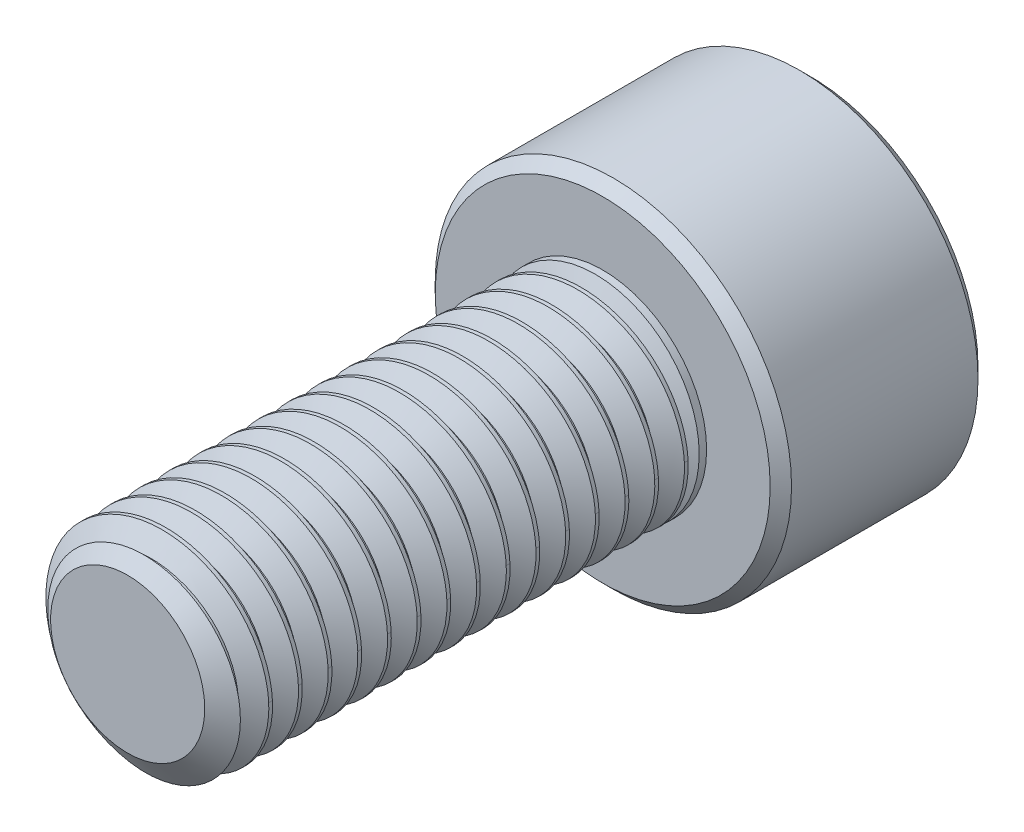
from build123d import *

# Parameters (mm, degrees)
SKETCH1_R          = 3.5
EXTRUDE1_DEPTH     = 16
CUT_SWEEP1_PITCH   = 1
SKETCH6_R          = 6
EXTRUDE2_DEPTH     = 7
CUT_EXTRUDE1_DEPTH = 4.5
CHAMFER1_SIZE      = 0.36


with BuildPart() as part:
    # Sketch1 → Extrude1 (new body)
    with BuildSketch(Plane.XY):
        Circle(SKETCH1_R)
    extrude(amount=-EXTRUDE1_DEPTH)

    # Cut-Sweep1: the profile of Sketch3 profile screwed along a right-hand helix of 17 turns, 6 arcs to a turn; built about Z, then put on its axis
    cut_sweep1_z = Axis((0, 0, 0), (0, 0, 1))
    cut_sweep1_corners = [(3.5003, 0, -0.875173205), (2.850480947, 0, -0.5), (2.850480947, 0, -0.375), (3.5003, 0, 0.000173205)]
    with BuildLine(mode=Mode.PRIVATE) as cut_sweep1_profile:
        Line(cut_sweep1_corners[0], cut_sweep1_corners[1])
        Line(cut_sweep1_corners[1], cut_sweep1_corners[2])
        Line(cut_sweep1_corners[2], cut_sweep1_corners[3])
        Line(cut_sweep1_corners[3], cut_sweep1_corners[0])
    cut_sweep1_cap = Face(cut_sweep1_profile.wire())
    cut_sweep1_turn_angles = [0, 30, 60, 90, 120, 150, 180, 210, 240, 270, 300, 330, 360]
    cut_sweep1_turn_weights = [1, 0.8660254037844387, 1, 0.8660254037844387, 1, 0.8660254037844387, 1, 0.8660254037844387, 1, 0.8660254037844387, 1, 0.8660254037844387, 1]
    cut_sweep1_turn_rails = [Edge.make_bspline([Vector(p[0], p[1], 0).rotate(cut_sweep1_z, cut_sweep1_turn_angles[k]) / cut_sweep1_turn_weights[k] + Vector(0, 0, p[2] + CUT_SWEEP1_PITCH * cut_sweep1_turn_angles[k] / 360) for k in range(13)], [0, 0, 0, 1, 1, 2, 2, 3, 3, 4, 4, 5, 5, 6, 6, 6], 2, cut_sweep1_turn_weights) for p in cut_sweep1_corners]
    cut_sweep1_turn_sides = [Face.make_surface_from_curves(cut_sweep1_turn_rails[p[0]], cut_sweep1_turn_rails[p[1]]) for p in [(0, 1), (1, 2), (2, 3), (3, 0)]]
    cut_sweep1 = Plane(origin=(0, 0, 0), x_dir=(0, 1, 0), z_dir=(0, 0, -1)) * Solid(Shell([*[p.moved(Location((0, 0, CUT_SWEEP1_PITCH * i))) for i in range(17) for p in cut_sweep1_turn_sides], cut_sweep1_cap, cut_sweep1_cap.rotate(cut_sweep1_z, 6120).moved(Location((0, 0, CUT_SWEEP1_PITCH * 6120 / 360)))]))
    add(cut_sweep1, mode=Mode.SUBTRACT)

    # Sketch4 → Cut-Revolve1 (revolve, cut)
    with BuildSketch(Plane(origin=(0, 0, 0), x_dir=(0, 0, -1), z_dir=(1, 0, 0)), mode=Mode.PRIVATE) as cut_revolve1_sk:
        Polygon((0.632650852, 3.5), (0, 2.596480947), (0, 3.5), align=None)
    revolve(cut_revolve1_sk.sketch.rotate(Axis((0, 0, 0), (0, 0, -1)), 90), axis=Axis((0, 0, 0), (0, 0, -1)), mode=Mode.SUBTRACT)

    # Sketch6 → Extrude2 (add)
    with BuildSketch(Plane(origin=(0, 0, -16), x_dir=(-1, 0, 0), z_dir=(0, 0, -1))):
        Circle(SKETCH6_R)
    extrude(amount=EXTRUDE2_DEPTH)

    # Sketch7 → Cut-Extrude1 (cut)
    with BuildSketch(Plane(origin=(0, 0, -23), x_dir=(-1, 0, 0), z_dir=(0, 0, -1))):
        Polygon((0, 3.464101615), (-3, 1.732050808), (-3, -1.732050808), (0, -3.464101615), (3, -1.732050808), (3, 1.732050808), align=None)
    extrude(amount=-CUT_EXTRUDE1_DEPTH, mode=Mode.SUBTRACT)

    # Cut-Extrude2 cone 1 section (through the dimple's axis) → Cut-Extrude2 (revolve, cut)
    with BuildSketch(Plane(origin=(0, 0, -23), x_dir=(0, 1, 0), z_dir=(1, 0, 0))):
        Polygon((0, 0), (3.464101615, 0), (0, 3.464101615), align=None)
    revolve(axis=Axis((0, 0, -23), (0, 0, 1)), mode=Mode.SUBTRACT)

    # Chamfer1
    chamfer1_edges = [part.edges().sort_by_distance(p)[0] for p in [
        (6, 0, -16),
        (6, 0, -23),
    ]]
    chamfer(chamfer1_edges, length=CHAMFER1_SIZE)

    # Sketch10 → Revolve1 (revolve)
    with BuildSketch(Plane(origin=(0, 0, 0), x_dir=(0, 0, -1), z_dir=(1, 0, 0)), mode=Mode.PRIVATE) as revolve1_sk:
        Polygon((16, 3.5), (16, 0), (14.300252532, 0), (15.75, 3.5), align=None)
    revolve(revolve1_sk.sketch.rotate(Axis((0, 0, -16), (0, 0, 1)), 270), axis=Axis((0, 0, -16), (0, 0, 1)))


solid = part.part
